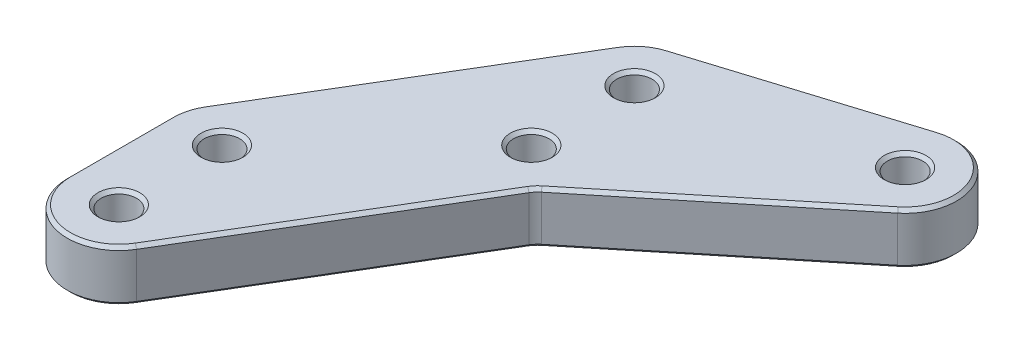
from build123d import *

# Parameters (mm, degrees)
SKETCH1_R           = 2.1828125
BOSS_EXTRUDE1_DEPTH = 3.175
CHAMFER1_SIZE       = 0.396875


with BuildPart() as part:
    # Sketch1 → Boss-Extrude1 (new, symmetric)
    with BuildSketch(Plane(origin=(0, 0, 0), x_dir=(1, 0, 0), z_dir=(0, 1, 0))):
        with BuildLine():
            Line((-25.4, -19.05), (-25.4, -31.75))
            ThreePointArc((-25.4, -31.75), (-20.745028245, -37.869589794), (-13.604919922, -35.017048047))
            Line((-13.604919922, -35.017048047), (4.519073196, -4.810392851))
            ThreePointArc((4.519073196, -4.810392851), (4.841622185, -4.365295225), (5.236106863, -3.98250078))
            Line((5.236106863, -3.98250078), (29.411012744, 15.71466781))
            ThreePointArc((29.411012744, 15.71466781), (30.992963694, 23.644368325), (23.505953794, 26.698447861))
            Line((23.505953794, 26.698447861), (-1.894046206, 18.760947861))
            ThreePointArc((-1.894046206, 18.760947861), (-3.926469495, 17.690524752), (-5.445080078, 15.967048047))
            Line((-5.445080078, 15.967048047), (-24.495080078, -15.782951953))
            ThreePointArc((-24.495080078, -15.782951953), (-25.169589794, -17.354971755), (-25.4, -19.05))
        make_face()
        Circle(SKETCH1_R, mode=Mode.SUBTRACT)
        with Locations((0, 12.7)):
            Circle(SKETCH1_R, mode=Mode.SUBTRACT)
        with Locations((-19.05, -19.05)):
            Circle(SKETCH1_R, mode=Mode.SUBTRACT)
        with Locations((-19.05, -31.75)):
            Circle(SKETCH1_R, mode=Mode.SUBTRACT)
        with Locations((25.4, 20.6375)):
            Circle(SKETCH1_R, mode=Mode.SUBTRACT)
    extrude(amount=BOSS_EXTRUDE1_DEPTH, both=True)

    # Chamfer1
    chamfer1_edges = [part.edges().sort_by_distance(p)[0] for p in [
        (23.2171875, -3.175, -20.6375),
        (-21.2328125, -3.175, 19.05),
        (-2.1828125, -3.175, 0),
        (17.323559803, -3.175, -5.866083515),
        (30.992963694, -3.175, -23.644368325),
        (10.805953794, -3.175, -22.729697861),
        (-3.926469495, -3.175, -17.690524752),
        (-14.970080078, -3.175, -0.092048047),
        (-25.169589794, -3.175, 17.354971755),
        (-25.4, -3.175, 25.4),
        (-20.745028245, -3.175, 37.869589794),
        (-4.542923363, -3.175, 19.913720449),
        (4.841622185, -3.175, 4.365295225),
        (-2.1828125, -3.175, -12.7),
        (-21.2328125, -3.175, 31.75),
        (23.2171875, 3.175, -20.6375),
        (-21.2328125, 3.175, 31.75),
        (-21.2328125, 3.175, 19.05),
        (-2.1828125, 3.175, -12.7),
        (-2.1828125, 3.175, 0),
        (-4.542923363, 3.175, 19.913720449),
        (-20.745028245, 3.175, 37.869589794),
        (-25.4, 3.175, 25.4),
        (-25.169589794, 3.175, 17.354971755),
        (-14.970080078, 3.175, -0.092048047),
        (-3.926469495, 3.175, -17.690524752),
        (10.805953794, 3.175, -22.729697861),
        (30.992963694, 3.175, -23.644368325),
        (17.323559803, 3.175, -5.866083515),
        (4.841622185, 3.175, 4.365295225),
    ]]
    chamfer(chamfer1_edges, length=CHAMFER1_SIZE)


solid = part.part
